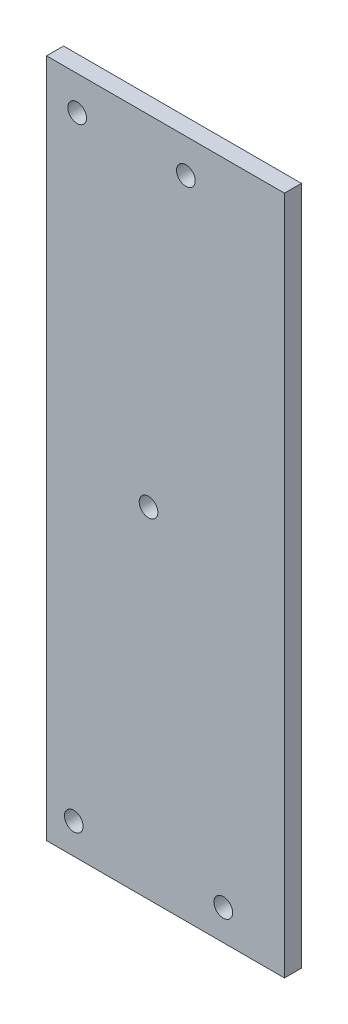
from build123d import *

# Parameters (mm, degrees)
SKETCH_1_W          = 100
SKETCH_1_H          = 200
EXTRUDE_1_DEPTH     = 5
CUT_EXTRUDE_2_DEPTH = 0.001
SKETCH_13_W         = 10
SKETCH_13_H         = 200
CUT_EXTRUDE_4_DEPTH = 10
SKETCH_14_W         = 10
SKETCH_14_H         = 200
CUT_EXTRUDE_5_DEPTH = 10
SKETCH_15_R         = 2.75
CUT_EXTRUDE_6_DEPTH = 108.819293394
SKETCH_17_R         = 2.75
CUT_EXTRUDE_8_DEPTH = 10
SKETCH_18_R         = 2.75
CUT_EXTRUDE_9_DEPTH = 10


with BuildPart() as part:
    # 스케치1 → 보스-돌출1 (new body)
    with BuildSketch(Plane.XY):
        Rectangle(SKETCH_1_W, SKETCH_1_H)
    extrude(amount=EXTRUDE_1_DEPTH)

    # 스케치3 → 컷-돌출2 (cut)
    # profile 1 of 5: a face of its own
    with BuildSketch(Plane(origin=(0, 0, 0), x_dir=(-1, 0, 0), z_dir=(0, 0, -1))):
        with BuildLine():
            Line((1.435897436, 3.568709936), (1.435897436, 3.241987179))
            add(Edge.make_bspline(
                [(1.435897436, 3.241987179), (1.406158657, 3.253938052), (1.349713836, 3.276621056), (1.26647346, 3.301285681), (1.189944626, 3.317221421), (1.140790736, 3.319457366), (1.117588141, 3.320512821)],
                knots=[0, 0, 0, 0, 1.16548392, 2.212112691, 3.15604595, 4, 4, 4, 4], degree=3))
            add(Edge.make_bspline(
                [(1.117588141, 3.320512821), (1.101914377, 3.31986148), (1.071575198, 3.318600703), (1.027971871, 3.312172427), (0.988682661, 3.299069626), (0.953777041, 3.28204035), (0.924826581, 3.260686166), (0.900040357, 3.239230902), (0.882073827, 3.215045722), (0.872318879, 3.192525311), (0.866368878, 3.171674318), (0.86457875, 3.150320052), (0.860193836, 3.124095966), (0.858971029, 3.091932248), (0.856183661, 3.054829537), (0.856430302, 3.012002641), (0.854146379, 2.964125498), (0.854488293, 2.930224949), (0.854667468, 2.912459936)],
                knots=[0, 0, 0, 0, 1.311993654, 2.539582093, 3.670788641, 4.763509788, 5.772417512, 6.671800701, 7.496729179, 8.266799162, 8.712543678, 9.304149002, 10.05334463, 10.934920737, 11.99209668, 13.165090968, 14.514413552, 16, 16, 16, 16], degree=3))
            Line((0.854667468, 2.912459936), (0.854667468, 2.557692308))
            Line((0.854667468, 2.557692308), (1.391025641, 2.557692308))
            Line((1.391025641, 2.557692308), (1.391025641, 2.243589744))
            Line((1.391025641, 2.243589744), (0.853966346, 2.243589744))
            Line((0.853966346, 2.243589744), (0.852564103, 0))
            Line((0.852564103, 0), (0.538461538, 0))
            Line((0.538461538, 0), (0.538461538, 2.243589744))
            Line((0.538461538, 2.243589744), (0.179487179, 2.243589744))
            Line((0.179487179, 2.243589744), (0.179487179, 2.557692308))
            Line((0.179487179, 2.557692308), (0.538461538, 2.557692308))
            Line((0.538461538, 2.557692308), (0.538461538, 2.966446314))
            add(Edge.make_bspline(
                [(0.538461538, 2.966446314), (0.538486753, 2.989121894), (0.538535124, 3.032622798), (0.541922975, 3.095232239), (0.544818696, 3.153055703), (0.550586323, 3.205644336), (0.557248029, 3.253490479), (0.566784189, 3.29588336), (0.57579556, 3.333965119), (0.592144152, 3.377067776), (0.616566371, 3.4259178), (0.656096568, 3.4775417), (0.703489575, 3.523846647), (0.760097899, 3.562854), (0.823813434, 3.595269478), (0.894694612, 3.618511331), (0.97196981, 3.631651776), (1.02545728, 3.633605985), (1.053084936, 3.634615385)],
                knots=[0, 0, 0, 0, 1.116398763, 2.141702935, 3.087165306, 3.966655413, 4.746276475, 5.464069668, 6.106083417, 6.67047701, 7.730773247, 8.782666744, 9.856985883, 10.980834087, 12.154321827, 13.366232824, 14.639591414, 16, 16, 16, 16], degree=3))
            add(Edge.make_bspline(
                [(1.053084936, 3.634615385), (1.081161694, 3.633658004), (1.140107358, 3.631648034), (1.232303961, 3.619214627), (1.331900478, 3.597743597), (1.400236399, 3.578665712), (1.435897436, 3.568709936)],
                knots=[0, 0, 0, 0, 0.864728408, 1.815451418, 2.859995356, 4, 4, 4, 4], degree=3))
        make_face()
    # profile 2 of 5: a face of its own
    with BuildSketch(Plane(origin=(0, 0, 0), x_dir=(-1, 0, 0), z_dir=(0, 0, -1))):
        with BuildLine():
            Line((1.794871795, 2.557692308), (2.108974359, 2.557692308))
            Line((2.108974359, 2.557692308), (2.108974359, 2.181189904))
            add(Edge.make_bspline(
                [(2.108974359, 2.181189904), (2.132163118, 2.216245732), (2.176511439, 2.283289731), (2.250224368, 2.371959032), (2.325727699, 2.445374079), (2.403382887, 2.503877598), (2.483760987, 2.547690717), (2.565097938, 2.579783752), (2.648673408, 2.598761067), (2.704835332, 2.601294726), (2.732972756, 2.602564103)],
                knots=[0, 0, 0, 0, 1.2804753, 2.448899062, 3.506932113, 4.484331642, 5.4025378, 6.288909075, 7.142734305, 8, 8, 8, 8], degree=3))
            add(Edge.make_bspline(
                [(2.732972756, 2.602564103), (2.754799083, 2.601373576), (2.799708168, 2.59892399), (2.867690758, 2.581713165), (2.93773421, 2.554235143), (2.982876597, 2.52839492), (3.006410256, 2.514923878)],
                knots=[0, 0, 0, 0, 0.901110191, 1.854092781, 2.881294221, 4, 4, 4, 4], degree=3))
            Line((3.006410256, 2.514923878), (2.833934295, 2.242888622))
            add(Edge.make_bspline(
                [(2.833934295, 2.242888622), (2.818825274, 2.249628888), (2.790145459, 2.262423203), (2.748190893, 2.277565213), (2.709509556, 2.286481129), (2.684865998, 2.287831847), (2.673377404, 2.288461538)],
                knots=[0, 0, 0, 0, 1.180555205, 2.24091978, 3.179933427, 4, 4, 4, 4], degree=3))
            add(Edge.make_bspline(
                [(2.673377404, 2.288461538), (2.64817167, 2.286781501), (2.59675928, 2.283354712), (2.521274781, 2.256415904), (2.448027575, 2.212890664), (2.389855913, 2.164619552), (2.34481366, 2.118071755), (2.312673435, 2.077423352), (2.283190688, 2.031844721), (2.255020467, 1.982115037), (2.229354173, 1.927385191), (2.205399504, 1.868201977), (2.183740641, 1.804496849), (2.171390397, 1.760114328), (2.165064103, 1.737379808)],
                knots=[0, 0, 0, 0, 1.125678352, 2.296057538, 3.5422874, 4.923748041, 5.663163013, 6.437101912, 7.23742474, 8.08941207, 8.991984279, 9.93940061, 10.944477711, 12, 12, 12, 12], degree=3))
            add(Edge.make_bspline(
                [(2.165064103, 1.737379808), (2.160331709, 1.717102634), (2.149849818, 1.672190235), (2.13965828, 1.596841711), (2.129588762, 1.507818052), (2.122492143, 1.404871459), (2.115914101, 1.288259015), (2.112204019, 1.15780307), (2.109100878, 1.013369718), (2.109017812, 0.912395365), (2.108974359, 0.859575321)],
                knots=[0, 0, 0, 0, 0.566838948, 1.255505196, 2.06880316, 3.007127437, 4.065329342, 5.249902469, 6.561414163, 8, 8, 8, 8], degree=3))
            Line((2.108974359, 0.859575321), (2.108974359, 0))
            Line((2.108974359, 0), (1.794871795, 0))
            Line((1.794871795, 0), (1.794871795, 2.557692308))
        make_face()
    # profile 3 of 5: a face of its own
    with BuildSketch(Plane(origin=(0, 0, 0), x_dir=(-1, 0, 0), z_dir=(0, 0, -1))):
        with BuildLine():
            add(Edge.make_bspline(
                [(4.555889423, 2.602564103), (4.603880696, 2.601542211), (4.697979853, 2.599538533), (4.835787739, 2.578123567), (4.967332875, 2.545376203), (5.093119067, 2.500104641), (5.211535363, 2.43942269), (5.324306607, 2.367013399), (5.431123616, 2.281230805), (5.495146645, 2.214872737), (5.527644231, 2.181189904)],
                knots=[0, 0, 0, 0, 1.054011418, 2.066658804, 3.057071809, 4.030435133, 4.997543892, 5.974964718, 6.972108034, 8, 8, 8, 8], degree=3))
            add(Edge.make_bspline(
                [(5.527644231, 2.181189904), (5.555626185, 2.148975918), (5.611048565, 2.085171376), (5.682114284, 1.981715763), (5.743335844, 1.874575662), (5.792398805, 1.762328336), (5.831083829, 1.645953664), (5.858549525, 1.525051653), (5.87488646, 1.399889306), (5.877089427, 1.314885468), (5.878205128, 1.271834936)],
                knots=[0, 0, 0, 0, 1.025258237, 2.030674902, 3.01204498, 3.988269485, 4.97094183, 5.956517959, 6.965070386, 8, 8, 8, 8], degree=3))
            add(Edge.make_bspline(
                [(5.878205128, 1.271834936), (5.877223791, 1.228534878), (5.875284623, 1.142971945), (5.856941006, 1.016952579), (5.82840992, 0.894757756), (5.787578082, 0.776899063), (5.735219973, 0.663016235), (5.671329285, 0.553606686), (5.595457668, 0.448454553), (5.509453671, 0.348452714), (5.414401795, 0.2562865), (5.311285647, 0.17595823), (5.202131613, 0.107136706), (5.08548826, 0.05170029), (4.962420773, 0.00799059), (4.832663705, -0.022709427), (4.696418635, -0.04127111), (4.603391413, -0.043654684), (4.555889423, -0.044871795)],
                knots=[0, 0, 0, 0, 0.998656419, 1.973391657, 2.932242238, 3.890759089, 4.846373663, 5.82037756, 6.809684879, 7.83454468, 8.860553229, 9.859544525, 10.845671541, 11.83227036, 12.833544569, 13.85385346, 14.904124723, 16, 16, 16, 16], degree=3))
            add(Edge.make_bspline(
                [(4.555889423, -0.044871795), (4.508154704, -0.043650599), (4.414663844, -0.041258824), (4.277937862, -0.022781541), (4.147948243, 0.007976441), (4.024719644, 0.051843934), (3.907574798, 0.107138478), (3.797788301, 0.175750167), (3.694588385, 0.256310322), (3.599516401, 0.348446259), (3.513517795, 0.448456216), (3.437644787, 0.553606254), (3.373754461, 0.663016348), (3.321396257, 0.776899033), (3.280564444, 0.894757764), (3.252033351, 1.016952577), (3.233689737, 1.142971945), (3.231750568, 1.228534878), (3.230769231, 1.271834936)],
                knots=[0, 0, 0, 0, 1.099876186, 2.154163076, 3.173186993, 4.173200201, 5.163417411, 6.152872554, 7.150605724, 8.17532212, 9.198891216, 10.186952605, 11.159729845, 12.11414092, 13.071450619, 14.029093627, 15.002601286, 16, 16, 16, 16], degree=3))
            add(Edge.make_bspline(
                [(3.230769231, 1.271834936), (3.231892541, 1.314651482), (3.234116503, 1.399420884), (3.250437012, 1.524347945), (3.277795568, 1.645045334), (3.316526965, 1.76097081), (3.366042155, 1.872726246), (3.426403443, 1.980131077), (3.498194076, 2.083118877), (3.553396027, 2.146840957), (3.581330128, 2.179086538)],
                knots=[0, 0, 0, 0, 1.031353054, 2.041901799, 3.029428768, 4.008703097, 4.981709435, 5.96992636, 6.972712378, 8, 8, 8, 8], degree=3))
            add(Edge.make_bspline(
                [(3.581330128, 2.179086538), (3.613778719, 2.213061478), (3.677594583, 2.279879174), (3.784943311, 2.365411698), (3.897437132, 2.439327772), (4.017162058, 2.498803987), (4.142844916, 2.545642505), (4.275064159, 2.57820802), (4.413339674, 2.599461375), (4.507899295, 2.601519553), (4.555889423, 2.602564103)],
                knots=[0, 0, 0, 0, 1.027980169, 2.021703884, 2.998553061, 3.971491411, 4.943284454, 5.930300938, 6.949603206, 8, 8, 8, 8], degree=3))
        make_face()
        with BuildLine():
            add(Edge.make_bspline(
                [(4.554487179, 2.288461538), (4.520549568, 2.287496947), (4.453550439, 2.285592664), (4.354930855, 2.27110876), (4.259990701, 2.248161255), (4.168549857, 2.215557199), (4.080916684, 2.1734583), (3.997007282, 2.12174994), (3.916574842, 2.061116984), (3.841192779, 1.991654312), (3.772010466, 1.915775317), (3.71153249, 1.834926959), (3.660107384, 1.750420612), (3.617267225, 1.662168401), (3.585360036, 1.569275987), (3.562187014, 1.472795356), (3.547716774, 1.37252994), (3.545830395, 1.304368921), (3.544871795, 1.269731571)],
                knots=[0, 0, 0, 0, 1.021534396, 2.016698045, 2.994645724, 3.958388632, 4.93408049, 5.916473867, 6.921342795, 7.962252576, 8.998418191, 10.008913653, 10.997312074, 11.973003931, 12.956656626, 13.948281152, 14.957379055, 16, 16, 16, 16], degree=3))
            add(Edge.make_bspline(
                [(3.544871795, 1.269731571), (3.546478619, 1.224979543), (3.549667863, 1.136155138), (3.575603099, 1.005344015), (3.618989379, 0.879762163), (3.677576659, 0.760145777), (3.750982878, 0.649473499), (3.837469944, 0.550802015), (3.936109645, 0.465616203), (4.045726145, 0.394935358), (4.164080463, 0.338775602), (4.289336784, 0.298976626), (4.419977478, 0.273104934), (4.509258209, 0.270533459), (4.554487179, 0.269230769)],
                knots=[0, 0, 0, 0, 1.016792936, 2.018143844, 3.017858371, 4.030088057, 5.03801393, 6.028138512, 7.003788237, 7.991172063, 8.984598303, 9.972568034, 10.972917682, 12, 12, 12, 12], degree=3))
            add(Edge.make_bspline(
                [(4.554487179, 0.269230769), (4.599713548, 0.270541049), (4.688989144, 0.273127506), (4.819448321, 0.298846326), (4.944362293, 0.338949987), (5.062593681, 0.394872197), (5.172160284, 0.465884611), (5.271509405, 0.550320988), (5.357258017, 0.64973484), (5.430591621, 0.760292369), (5.490138364, 0.879576721), (5.533321566, 1.005367193), (5.559319152, 1.136149235), (5.562499981, 1.224977566), (5.564102564, 1.269731571)],
                knots=[0, 0, 0, 0, 1.02726834, 2.027799167, 3.010890988, 4.004497153, 4.992059811, 5.971914811, 6.958719428, 7.966827853, 8.981595046, 9.981490638, 10.983022906, 12, 12, 12, 12], degree=3))
            add(Edge.make_bspline(
                [(5.564102564, 1.269731571), (5.563144294, 1.304369128), (5.561258565, 1.372530554), (5.546783601, 1.472793007), (5.523628061, 1.569284604), (5.491656444, 1.662136607), (5.44900243, 1.750649112), (5.396585637, 1.834678839), (5.336354611, 1.916055385), (5.26633749, 1.991409026), (5.191034113, 2.061144062), (5.110569074, 2.121773452), (5.026784096, 2.173231047), (4.939405513, 2.215917288), (4.847952945, 2.247864628), (4.753145816, 2.271241259), (4.654947006, 2.285531456), (4.588187963, 2.287478598), (4.554487179, 2.288461538)],
                knots=[0, 0, 0, 0, 1.042956736, 2.052379634, 3.044323526, 4.02829302, 5.004299113, 5.996692471, 7.007513377, 8.048758398, 9.090003419, 10.095195979, 11.07790575, 12.047570684, 13.018257071, 13.989683339, 14.985167495, 16, 16, 16, 16], degree=3))
        make_face(mode=Mode.SUBTRACT)
    # profile 4 of 5: a face of its own
    with BuildSketch(Plane(origin=(0, 0, 0), x_dir=(-1, 0, 0), z_dir=(0, 0, -1))):
        with BuildLine():
            Line((6.506410256, 2.557692308), (6.820512821, 2.557692308))
            Line((6.820512821, 2.557692308), (6.820512821, 2.096354167))
            add(Edge.make_bspline(
                [(6.820512821, 2.096354167), (6.854050456, 2.13819689), (6.919131407, 2.219394153), (7.02751574, 2.326114728), (7.14205964, 2.414059953), (7.262061644, 2.484163747), (7.387684654, 2.537010373), (7.518162924, 2.575176304), (7.65427763, 2.598061132), (7.746842067, 2.601051363), (7.793669872, 2.602564103)],
                knots=[0, 0, 0, 0, 1.12780773, 2.188550248, 3.19190651, 4.159438251, 5.104880172, 6.052711206, 7.014878035, 8, 8, 8, 8], degree=3))
            add(Edge.make_bspline(
                [(7.793669872, 2.602564103), (7.841000506, 2.600818907), (7.933637974, 2.597403139), (8.068516035, 2.570386448), (8.194489429, 2.524241192), (8.311108985, 2.461029122), (8.416236198, 2.382422649), (8.508561049, 2.290844867), (8.584924297, 2.185508784), (8.63612166, 2.087785627), (8.669847307, 2.001096833), (8.691079645, 1.926850083), (8.709110626, 1.844131932), (8.724742374, 1.753192343), (8.735319486, 1.653394153), (8.743661778, 1.545146461), (8.749640472, 1.42848433), (8.749877679, 1.347797703), (8.75, 1.306189904)],
                knots=[0, 0, 0, 0, 1.235846778, 2.418850247, 3.575807741, 4.728682307, 5.871620074, 6.994088408, 8.11269785, 9.256955736, 9.865816715, 10.540099792, 11.271859618, 12.076849838, 12.949306005, 13.892391288, 14.913166135, 16, 16, 16, 16], degree=3))
            Line((8.75, 1.306189904), (8.75, 0))
            Line((8.75, 0), (8.435897436, 0))
            Line((8.435897436, 0), (8.435897436, 1.203125))
            add(Edge.make_bspline(
                [(8.435897436, 1.203125), (8.435704228, 1.237947445), (8.435334654, 1.304556856), (8.434169007, 1.399925879), (8.431359201, 1.486412457), (8.427410888, 1.563809825), (8.421631857, 1.632043661), (8.415609226, 1.691252938), (8.408244249, 1.74136248), (8.401681336, 1.771527563), (8.398737981, 1.78505609)],
                knots=[0, 0, 0, 0, 1.430800155, 2.736877192, 3.918605307, 4.986035426, 5.920637409, 6.731861385, 7.431261377, 8, 8, 8, 8], degree=3))
            add(Edge.make_bspline(
                [(8.398737981, 1.78505609), (8.388112449, 1.824767275), (8.367661589, 1.901199019), (8.317127605, 2.004873372), (8.253313425, 2.09307156), (8.175415575, 2.165248281), (8.0841865, 2.221419118), (7.979879357, 2.260393073), (7.863500716, 2.284769342), (7.781646334, 2.287196474), (7.738982372, 2.288461538)],
                knots=[0, 0, 0, 0, 1.084156227, 2.086665306, 3.027808233, 3.945421172, 4.874247719, 5.839848303, 6.874090471, 8, 8, 8, 8], degree=3))
            add(Edge.make_bspline(
                [(7.738982372, 2.288461538), (7.713714688, 2.287985534), (7.663710595, 2.287043533), (7.589560623, 2.277592235), (7.51763645, 2.262133779), (7.447216241, 2.241265142), (7.379708447, 2.212602873), (7.312944156, 2.180073502), (7.249437392, 2.13952529), (7.187833995, 2.094334669), (7.130521187, 2.044255462), (7.077192849, 1.991410952), (7.029654829, 1.935135348), (6.986586153, 1.8763354), (6.94940789, 1.814203562), (6.916954802, 1.749339256), (6.889419107, 1.681657107), (6.875736415, 1.634682046), (6.868890224, 1.611177885)],
                knots=[0, 0, 0, 0, 1.023777757, 2.026029729, 3.023749952, 4.003683103, 4.997618607, 5.993177895, 7.010360494, 8.046726602, 9.087585522, 10.09234134, 11.086953743, 12.070360549, 13.043493632, 14.017870808, 15.008233677, 16, 16, 16, 16], degree=3))
            add(Edge.make_bspline(
                [(6.868890224, 1.611177885), (6.864950576, 1.593922682), (6.856374167, 1.556359007), (6.847110987, 1.494714588), (6.838703412, 1.423404613), (6.831666453, 1.342512296), (6.827361037, 1.251754421), (6.82266664, 1.151518583), (6.820957579, 1.041405094), (6.820665225, 0.964743402), (6.820512821, 0.924779647)],
                knots=[0, 0, 0, 0, 0.615963638, 1.340920617, 2.168419149, 3.115676021, 4.16674242, 5.331190069, 6.6087489, 8, 8, 8, 8], degree=3))
            Line((6.820512821, 0.924779647), (6.820512821, 0))
            Line((6.820512821, 0), (6.506410256, 0))
            Line((6.506410256, 0), (6.506410256, 2.557692308))
        make_face()
    # profile 5 of 5: a face of its own
    with BuildSketch(Plane(origin=(0, 0, 0), x_dir=(-1, 0, 0), z_dir=(0, 0, -1))):
        Polygon((9.782051282, 3.58974359), (10.096153846, 3.58974359), (10.096153846, 2.557692308), (10.544871795, 2.557692308), (10.544871795, 2.243589744), (10.096153846, 2.243589744), (10.096153846, 0), (9.782051282, 0), (9.782051282, 2.243589744), (9.333333333, 2.243589744), (9.333333333, 2.557692308), (9.782051282, 2.557692308), align=None)
    extrude(amount=-CUT_EXTRUDE_2_DEPTH, mode=Mode.SUBTRACT)

    # 스케치13 → 컷-돌출4 (cut)
    with BuildSketch(Plane.XY.offset(5)):
        with Locations((45, 0)):
            Rectangle(SKETCH_13_W, SKETCH_13_H)
        with Locations((-45, 0)):
            Rectangle(SKETCH_13_W, SKETCH_13_H)
    extrude(amount=-CUT_EXTRUDE_4_DEPTH, mode=Mode.SUBTRACT)

    # 스케치14 → 컷-돌출5 (cut)
    with BuildSketch(Plane.XY.offset(5)):
        with Locations((35, 0)):
            Rectangle(SKETCH_14_W, SKETCH_14_H)
    extrude(amount=-CUT_EXTRUDE_5_DEPTH, mode=Mode.SUBTRACT)

    # 스케치15 → 컷-돌출6 (cut, through all)
    with BuildSketch(Plane(origin=(0, 0, 0), x_dir=(-1, 0, 0), z_dir=(0, 0, -1))):
        with Locations((-1, 90)):
            Circle(SKETCH_15_R)
        with Locations((31, 90)):
            Circle(SKETCH_15_R)
    extrude(amount=-CUT_EXTRUDE_6_DEPTH, mode=Mode.SUBTRACT)

    # 스케치17 → 컷-돌출8 (cut)
    with BuildSketch(Plane(origin=(0, 0, 0), x_dir=(-1, 0, 0), z_dir=(0, 0, -1))):
        with Locations((10, 0)):
            Circle(SKETCH_17_R)
    extrude(amount=-CUT_EXTRUDE_8_DEPTH, mode=Mode.SUBTRACT)

    # 스케치18 → 컷-돌출9 (cut)
    with BuildSketch(Plane(origin=(0, 0, 0), x_dir=(-1, 0, 0), z_dir=(0, 0, -1))):
        with Locations((32, -91)):
            Circle(SKETCH_18_R)
        with Locations((-12, -91)):
            Circle(SKETCH_18_R)
    extrude(amount=-CUT_EXTRUDE_9_DEPTH, mode=Mode.SUBTRACT)


solid = part.part
